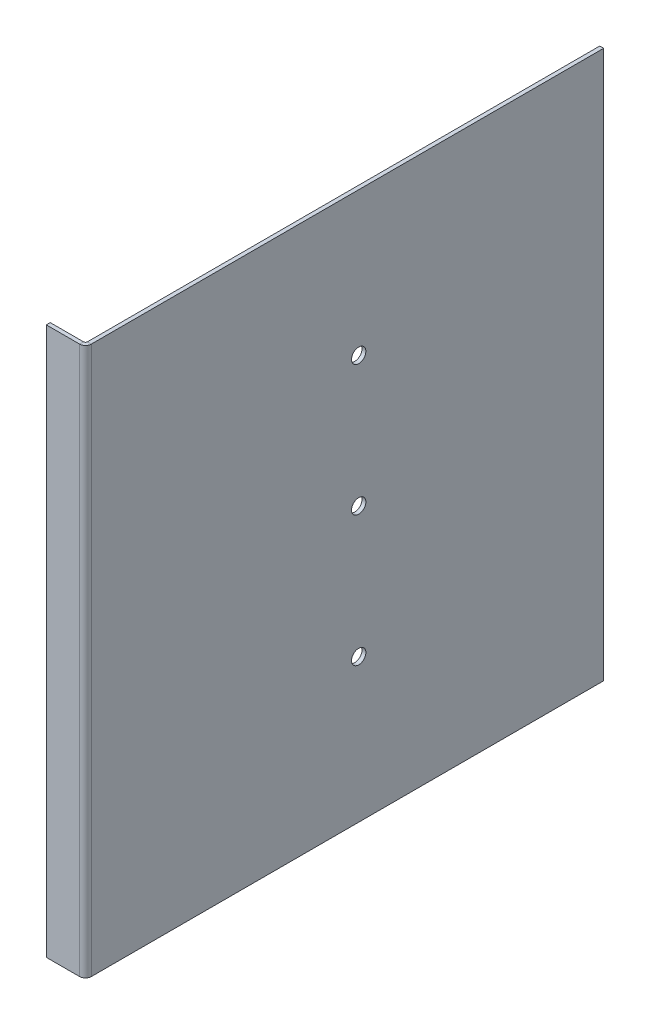
from build123d import *

# Parameters (mm, degrees)
SKETCH_1_W                       = 1.5
SKETCH_1_H                       = 210
SM_BASE_FLANGE_1_DEPTH           = 198.66
SKETCH_6_R                       = 2.75
CUT_EXTRUDE_1_DEPTH              = 10
SM_EDGE_FLANGE_1_STRIP_W         = 7.4732
SM_EDGE_FLANGE_1_STRIP_H         = 1.5
SM_EDGE_FLANGE_1_STRIP_CUT_DEPTH = 210
SM_EDGE_FLANGE_1_DEPTH           = 210


# Sheet-metal steps are written as plain solids
with BuildPart() as part:
    # Sketch 1 → 基体-法兰1 (new body)
    with BuildSketch(Plane.XY):
        with Locations((0.75, 105)):
            Rectangle(SKETCH_1_W, SKETCH_1_H)
    extrude(amount=SM_BASE_FLANGE_1_DEPTH)

    # 草图6 → 切除-拉伸1 (cut)
    with BuildSketch(Plane(origin=(1.5, 0, 0), x_dir=(0, 0, -1), z_dir=(1, 0, 0))):
        with Locations((-93.91, 55)):
            Circle(SKETCH_6_R)
        with Locations((-93.91, 155)):
            Circle(SKETCH_6_R)
        with Locations((-93.91, 105)):
            Circle(SKETCH_6_R)
    extrude(amount=-CUT_EXTRUDE_1_DEPTH, mode=Mode.SUBTRACT)

    # 边线-法兰1 strip (across the edge) → 边线-法兰1 strip cut (cut)
    with BuildSketch(Plane(origin=(0, 0, 198.66), x_dir=(0, 0, -1), z_dir=(0, 1, 0))):
        with Locations((-1.5, -0.75)):
            Rectangle(SM_EDGE_FLANGE_1_STRIP_W, SM_EDGE_FLANGE_1_STRIP_H)
    extrude(amount=SM_EDGE_FLANGE_1_STRIP_CUT_DEPTH, mode=Mode.SUBTRACT)

    # 边线-法兰1 section (across the edge) → 边线-法兰1 (add)
    with BuildSketch(Plane(origin=(0, 0, 198.66), x_dir=(0, 0, -1), z_dir=(0, 1, 0))):
        with BuildLine():
            Line((0, 0.7366), (0, 13.5))
            Line((0, 13.5), (1.5, 13.5))
            Line((1.5, 13.5), (1.5, 0.7366))
            ThreePointArc((1.5, 0.7366), (1.715745145, 0.215745145), (2.2366, 0))
            Line((2.2366, 0), (2.2366, -1.5))
            ThreePointArc((2.2366, -1.5), (0.655084973, -0.844915027), (0, 0.7366))
        make_face()
    extrude(amount=SM_EDGE_FLANGE_1_DEPTH)


solid = part.part
